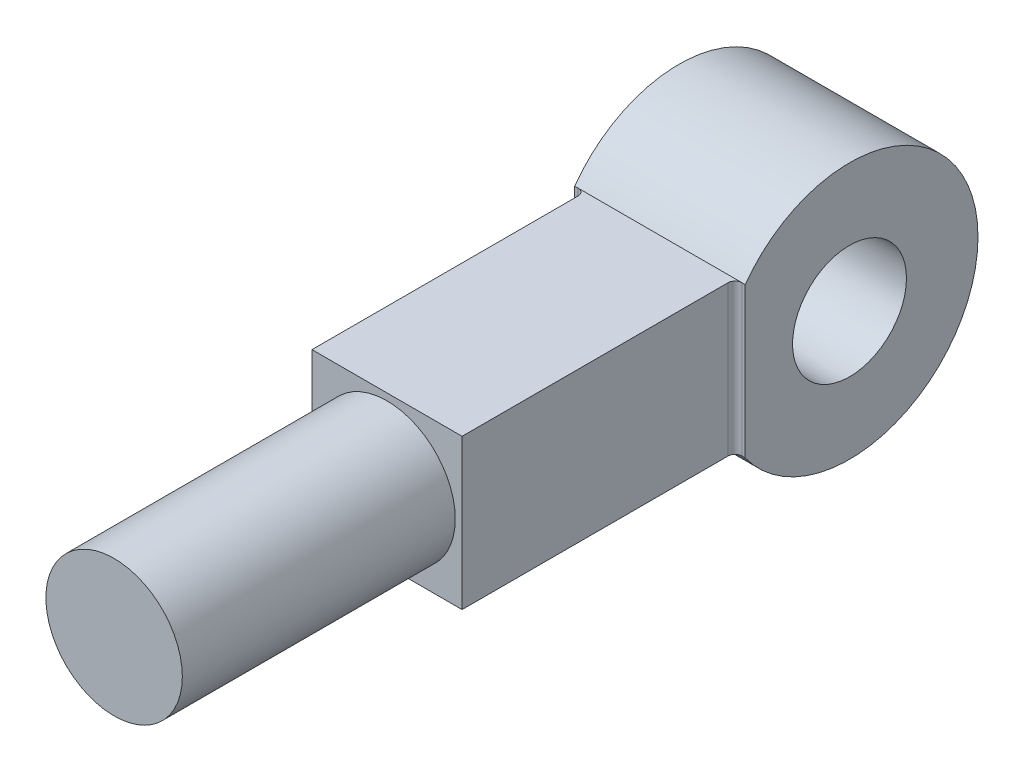
from build123d import *

# Parameters (mm, degrees)
SKETCH1_R           = 8.345
BOSS_EXTRUDE1_DEPTH = 25
CUT_EXTRUDE3_START  = -11
CUT_EXTRUDE3_DEPTH  = 22
SKETCH3_R           = 10
BOSS_EXTRUDE2_DEPTH = 40


# Read off the part's stored shape, not the designer's step: Cut-Extrude3
with BuildPart() as part:
    # Sketch1 → Boss-Extrude1 (new body)
    with BuildSketch(Plane(origin=(0, 0, 0), x_dir=(0, 0, -1), z_dir=(1, 0, 0))):
        with BuildLine():
            Line((-15.282961101, -11), (-55.282961101, -11))
            Line((-55.282961101, -11), (-55.282961101, 11))
            Line((-55.282961101, 11), (-15.282961101, 11))
            ThreePointArc((-15.282961101, 11), (18.83, 0), (-15.282961101, -11))
        make_face()
        Circle(SKETCH1_R, mode=Mode.SUBTRACT)
    extrude(amount=BOSS_EXTRUDE1_DEPTH)

    # Cut-Extrude3 outline → Cut-Extrude3 (cut)
    with BuildSketch(Plane(origin=(0, 0, 0), x_dir=(1, 0, 0), z_dir=(0, 1, 0)).offset(CUT_EXTRUDE3_START)):
        with BuildLine():
            Line((25, -55.282961101), (25, -15.282961101))
            Line((25, -15.282961101), (24.5, -15.282961101))
            ThreePointArc((24.5, -15.282961101), (23.792893218, -15.575854319), (23.5, -16.282961101))
            Line((23.5, -16.282961101), (23.5, -55.282961101))
            Line((23.5, -55.282961101), (25, -55.282961101))
        make_face()
        with BuildLine():
            Line((0, -55.282961101), (1.5, -55.282961101))
            Line((1.5, -55.282961101), (1.5, -16.282961101))
            ThreePointArc((1.5, -16.282961101), (1.207106782, -15.575854319), (0.5, -15.282961101))
            Line((0.5, -15.282961101), (0, -15.282961101))
            Line((0, -15.282961101), (0, -55.282961101))
        make_face()
    extrude(amount=CUT_EXTRUDE3_DEPTH, mode=Mode.SUBTRACT)

    # Sketch3 → Boss-Extrude2 (add)
    with BuildSketch(Plane.XY.offset(55.282961101)):
        with Locations((12.5, 0)):
            Circle(SKETCH3_R)
    extrude(amount=BOSS_EXTRUDE2_DEPTH)


solid = part.part
